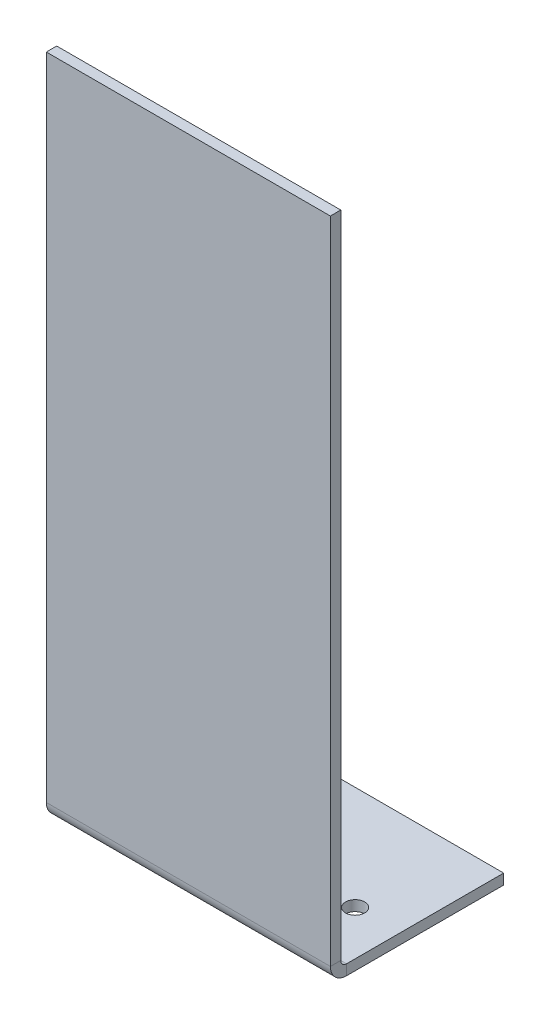
from build123d import *

# Parameters (mm, degrees)
SKETCH1_W              = 43.69375
SKETCH1_H              = 126.6
SKETCH1_R              = 1.4732
BASE_FLANGE1_DEPTH     = 1.6002
SKETCHED_BEND1_DEPTH   = 43.69375
SKETCHED_BEND1_2_DEPTH = 43.69375


# Read off the part's stored shape, not the designer's step: Sketched Bend1
# Sheet-metal steps are written as plain solids
with BuildPart() as part:
    # Sketch1 → Base-Flange1 (new body)
    with BuildSketch(Plane(origin=(0, 0, 0), x_dir=(1, 0, 0), z_dir=(0, 1, 0))):
        with Locations((21.846875, -63.3)):
            Rectangle(SKETCH1_W, SKETCH1_H)
        with Locations(Location((6.846875, -16.01, 0), (0, 0, 270))):
            Circle(SKETCH1_R, mode=Mode.SUBTRACT)
        with Locations(Location((36.846875, -16.01, 0), (0, 0, 270))):
            Circle(SKETCH1_R, mode=Mode.SUBTRACT)
    extrude(amount=-BASE_FLANGE1_DEPTH)

    # Sketched Bend1 outline → Sketched Bend1 (cut)
    with BuildSketch(Plane.YZ):
        with BuildLine():
            ThreePointArc((-1.6002, 24.173927493), (-1.16148963, 25.585171243), (0, 26.49896419))
            Line((0, 26.49896419), (0, 126.6))
            Line((0, 126.6), (-1.6002, 126.6))
            Line((-1.6002, 126.6), (-1.6002, 24.173927493))
        make_face()
    extrude(amount=SKETCHED_BEND1_DEPTH, mode=Mode.SUBTRACT)

    # Sketched Bend1 2 outline → Sketched Bend1 2 (add)
    with BuildSketch(Plane.YZ):
        with BuildLine():
            ThreePointArc((0, 24.173927493), (0.260382071, 24.802545421), (0.889, 25.062927493))
            Line((0.889, 25.062927493), (100.862927493, 25.062927493))
            Line((100.862927493, 25.062927493), (100.862927493, 26.663127493))
            Line((100.862927493, 26.663127493), (0.889, 26.663127493))
            ThreePointArc((0.889, 26.663127493), (0.436984903, 26.62174264), (0, 26.49896419))
            Line((0, 26.49896419), (0, 24.173927493))
        make_face()
    extrude(amount=SKETCHED_BEND1_2_DEPTH)


solid = part.part
